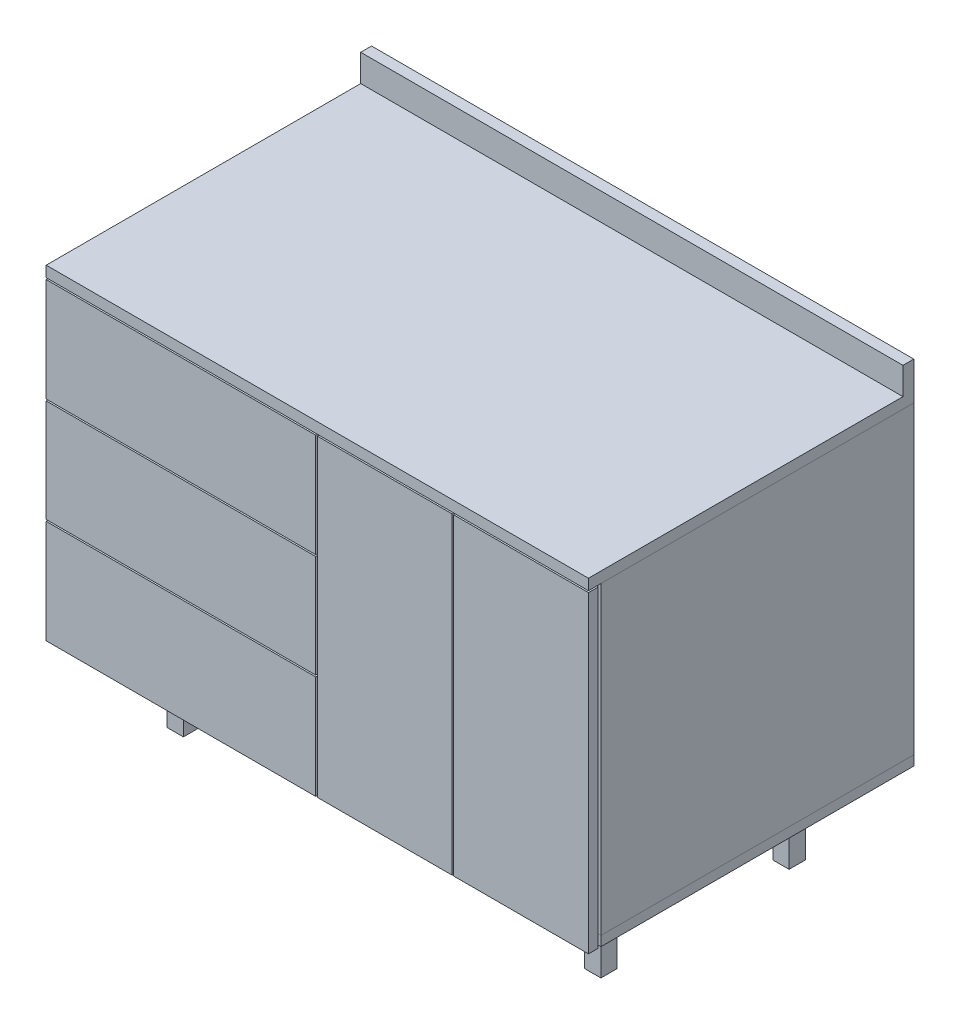
from build123d import *

# Parameters (mm, degrees)
CROQUIS1_W                = 1000
CROQUIS1_H                = 577
SALIENTE_EXTRUIR1_DEPTH   = 580
VACIADO1_T                = -18
CROQUIS2_W                = 1000
CROQUIS2_H                = 600
SALIENTE_EXTRUIR2_DEPTH   = 20
CROQUIS3_W                = 479
CROQUIS3_H                = 175.833333333
CROQUIS3_W_2              = 18
CROQUIS3_H_2              = 189.333333334
CROQUIS3_H_3              = 172.833333333
SALIENTE_EXTRUIR4_DEPTH   = 23
CROQUIS5_W                = 5
CROQUIS5_H                = 577
CORTAR_EXTRUIR1_DEPTH     = 1208.075908963
CROQUIS6_W                = 248.5
CROQUIS6_H                = 577
SALIENTE_EXTRUIR5_DEPTH   = 18
SALIENTE_EXTRUIR5_2_DEPTH = 18
PARTIR5_OUTLINE_W         = 1000
PARTIR5_OUTLINE_H         = 577
PARTIR5_DEPTH             = 18
PARTIR5_2_OUTLINE_W       = 1000
PARTIR5_2_OUTLINE_H       = 577
PARTIR5_2_DEPTH           = 18
PARTIR6_START             = 18
PARTIR6_OUTLINE_W         = 18
PARTIR6_OUTLINE_H         = 577
PARTIR6_DEPTH             = 562
PARTIR6_2_OUTLINE_W       = 18
PARTIR6_2_OUTLINE_H       = 577
PARTIR6_2_DEPTH           = 562
PARTIR6_START_2           = -500
PARTIR6_3_OUTLINE_W       = 562
PARTIR6_3_OUTLINE_H       = 577
PARTIR6_3_DEPTH           = 18
PARTIR6_START_3           = 482
PARTIR6_4_OUTLINE_W       = 562
PARTIR6_4_OUTLINE_H       = 577
PARTIR6_4_DEPTH           = 18
PARTIR11_START            = -482
PARTIR11_OUTLINE_W        = 544
PARTIR11_OUTLINE_H        = 18
PARTIR11_DEPTH            = 964
PARTIR11_START_2          = 18
PARTIR11_2_OUTLINE_W      = 964
PARTIR11_2_OUTLINE_H      = 18
PARTIR11_2_DEPTH          = 544
CROQUIS7_W                = 1000
CROQUIS7_H                = 20
SALIENTE_EXTRUIR6_DEPTH   = 50
CROQUIS8_W                = 30
CROQUIS8_H                = 30
SALIENTE_EXTRUIR7_DEPTH   = 150


# Read off the part's stored shape, not the designer's step: Partir5, Partir6, Partir11
with BuildPart() as part:
    # Croquis1 → Saliente-Extruir1 (new body)
    with BuildSketch(Plane(origin=(0, 0, 0), x_dir=(1, 0, 0), z_dir=(0, 1, 0))):
        Rectangle(CROQUIS1_W, CROQUIS1_H)
    extrude(amount=SALIENTE_EXTRUIR1_DEPTH)

    # Vaciado1
    vaciado1_openings = [part.faces().sort_by_distance(p)[0] for p in [
        (0, 290, 288.5),
    ]]
    offset(amount=VACIADO1_T, openings=vaciado1_openings, kind=Kind.INTERSECTION)

    # Croquis2 → Saliente-Extruir2 (add)
    with BuildSketch(Plane(origin=(0, 580, 0), x_dir=(1, 0, 0), z_dir=(0, 1, 0))):
        with Locations((0, -11.5)):
            Rectangle(CROQUIS2_W, CROQUIS2_H)
    extrude(amount=SALIENTE_EXTRUIR2_DEPTH)

    # Croquis3 → Saliente-Extruir4 (add)
    with BuildSketch(Plane.XY.offset(288.5)):
        Polygon((-3, 577), (-500, 577), (-500, 386.166666667), (-482, 386.166666667), (-482, 562), (-3, 562), align=None)
        with Locations((-242.5, 474.083333334)):
            Rectangle(CROQUIS3_W, CROQUIS3_H)
        with Locations((-491, 288.5)):
            Rectangle(CROQUIS3_W_2, CROQUIS3_H_2)
        with Locations((-242.5, 288.5)):
            Rectangle(CROQUIS3_W, CROQUIS3_H_2)
        Polygon((-482, 18), (-482, 190.833333333), (-500, 190.833333333), (-500, 0), (-3, 0), (-3, 18), align=None)
        with Locations((-242.5, 104.416666667)):
            Rectangle(CROQUIS3_W, CROQUIS3_H_3)
    extrude(amount=SALIENTE_EXTRUIR4_DEPTH)

    # Croquis5 → Cortar-Extruir1 (cut, through all)
    with BuildSketch(Plane.ZY.offset(500)):
        with Locations((291, 288.5)):
            Rectangle(CROQUIS5_W, CROQUIS5_H)
    extrude(amount=-CORTAR_EXTRUIR1_DEPTH, mode=Mode.SUBTRACT)


with BuildPart() as cortar_extruir1_piece_1:
    # of the separate pieces the step leaves, piece 1, a body of its own (cortar_extruir1_pieces)
    add(part.part.solids().sort_by_distance((-500, 0, -288.5))[0])

    # Partir5 2 outline → Partir5 2 (cut)
    with BuildSketch(Plane(origin=(0, 0, 0), x_dir=(1, 0, 0), z_dir=(0, 1, 0))):
        Rectangle(PARTIR5_2_OUTLINE_W, PARTIR5_2_OUTLINE_H)
    extrude(amount=PARTIR5_2_DEPTH, mode=Mode.SUBTRACT)

    # Partir6 3 outline → Partir6 3 (cut)
    with BuildSketch(Plane.YZ.offset(PARTIR6_START_2)):
        with Locations((299, 0)):
            Rectangle(PARTIR6_3_OUTLINE_W, PARTIR6_3_OUTLINE_H)
    extrude(amount=PARTIR6_3_DEPTH, mode=Mode.SUBTRACT)

    # Partir6 4 outline → Partir6 4 (cut)
    with BuildSketch(Plane.YZ.offset(PARTIR6_START_3)):
        with Locations((299, 0)):
            Rectangle(PARTIR6_4_OUTLINE_W, PARTIR6_4_OUTLINE_H)
    extrude(amount=PARTIR6_4_DEPTH, mode=Mode.SUBTRACT)

    # Partir11 outline → Partir11 (cut)
    with BuildSketch(Plane.YZ.offset(PARTIR11_START)):
        with Locations((290, -279.5)):
            Rectangle(PARTIR11_OUTLINE_W, PARTIR11_OUTLINE_H)
    extrude(amount=PARTIR11_DEPTH, mode=Mode.SUBTRACT)

    # Croquis7 → Saliente-Extruir6 (add)
    with BuildSketch(Plane(origin=(0, 600, 0), x_dir=(1, 0, 0), z_dir=(0, 1, 0))):
        with Locations((0, 278.5)):
            Rectangle(CROQUIS7_W, CROQUIS7_H)
    extrude(amount=SALIENTE_EXTRUIR6_DEPTH)


with BuildPart() as cortar_extruir1_piece_2:
    # of the separate pieces the step leaves, piece 2, a body of its own (cortar_extruir1_pieces)
    add(part.part.solids().sort_by_distance((-500, 386.166666667, 293.5))[0])


with BuildPart() as cortar_extruir1_piece_3:
    # of the separate pieces the step leaves, piece 3, a body of its own (cortar_extruir1_pieces)
    add(part.part.solids().sort_by_distance((-500, 190.833333333, 293.5))[0])


with BuildPart() as cortar_extruir1_piece_4:
    # of the separate pieces the step leaves, piece 4, a body of its own (cortar_extruir1_pieces)
    add(part.part.solids().sort_by_distance((-500, 193.833333333, 293.5))[0])


with BuildPart() as body_5:
    # Croquis6 → Saliente-Extruir5 (new body)
    with BuildSketch(Plane(origin=(0, 0, 293.5), x_dir=(-1, 0, 0), z_dir=(0, 0, -1))):
        with Locations((-124.25, 288.5)):
            Rectangle(CROQUIS6_W, CROQUIS6_H)
    extrude(amount=-SALIENTE_EXTRUIR5_DEPTH)


with BuildPart() as body_6:
    # Croquis6 → Saliente-Extruir5 2 (new body)
    with BuildSketch(Plane(origin=(0, 0, 293.5), x_dir=(-1, 0, 0), z_dir=(0, 0, -1))):
        with Locations((-375.75, 288.5)):
            Rectangle(CROQUIS6_W, CROQUIS6_H)
    extrude(amount=-SALIENTE_EXTRUIR5_2_DEPTH)


with BuildPart() as body_7:
    # Partir5 outline → Partir5 (new body)
    with BuildSketch(Plane(origin=(0, 0, 0), x_dir=(1, 0, 0), z_dir=(0, 1, 0))):
        Rectangle(PARTIR5_OUTLINE_W, PARTIR5_OUTLINE_H)
    extrude(amount=PARTIR5_DEPTH)

    # Croquis8 → Saliente-Extruir7 (add)
    with BuildSketch(Plane.XZ):
        with Locations((-385, 173.5)):
            Rectangle(CROQUIS8_W, CROQUIS8_H)
        with Locations((385, 173.5)):
            Rectangle(CROQUIS8_W, CROQUIS8_H)
        with Locations((385, -173.5)):
            Rectangle(CROQUIS8_W, CROQUIS8_H)
        with Locations((-385, -173.5)):
            Rectangle(CROQUIS8_W, CROQUIS8_H)
    extrude(amount=SALIENTE_EXTRUIR7_DEPTH)


with BuildPart() as body_8:
    # Partir6 outline → Partir6 (new body)
    with BuildSketch(Plane(origin=(0, 0, 0), x_dir=(1, 0, 0), z_dir=(0, 1, 0)).offset(PARTIR6_START)):
        with Locations((491, 0)):
            Rectangle(PARTIR6_OUTLINE_W, PARTIR6_OUTLINE_H)
    extrude(amount=PARTIR6_DEPTH)


with BuildPart() as body_9:
    # Partir6 2 outline → Partir6 2 (new body)
    with BuildSketch(Plane(origin=(0, 0, 0), x_dir=(1, 0, 0), z_dir=(0, 1, 0)).offset(PARTIR6_START)):
        with Locations((-491, 0)):
            Rectangle(PARTIR6_2_OUTLINE_W, PARTIR6_2_OUTLINE_H)
    extrude(amount=PARTIR6_2_DEPTH)


with BuildPart() as body_10:
    # Partir11 2 outline → Partir11 2 (new body)
    with BuildSketch(Plane(origin=(0, 0, 0), x_dir=(1, 0, 0), z_dir=(0, 1, 0)).offset(PARTIR11_START_2)):
        with Locations((0, 279.5)):
            Rectangle(PARTIR11_2_OUTLINE_W, PARTIR11_2_OUTLINE_H)
    extrude(amount=PARTIR11_2_DEPTH)


solid = Compound([cortar_extruir1_piece_1.part, cortar_extruir1_piece_2.part, cortar_extruir1_piece_3.part, cortar_extruir1_piece_4.part, body_5.part, body_6.part, body_7.part, body_8.part, body_9.part, body_10.part])
